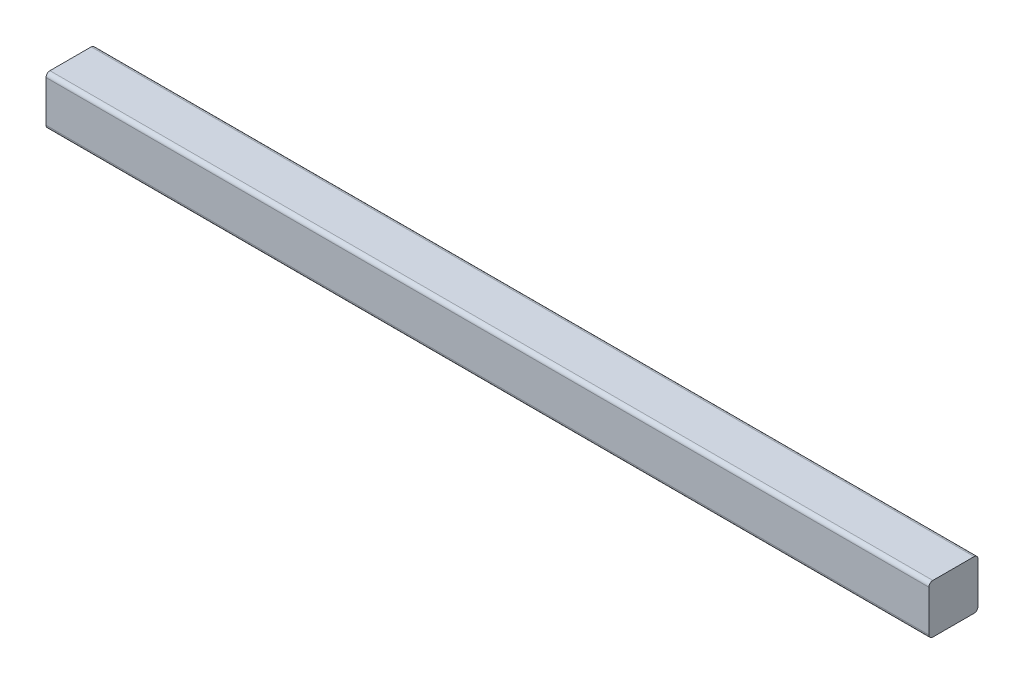
from build123d import *

# Parameters (mm, degrees)
SKETCH1_W           = 57.091934932
SKETCH1_H           = 3.175
BOSS_EXTRUDE1_DEPTH = 1.5875
FILLET1_R           = 0.254


with BuildPart() as part:
    # Sketch1 → Boss-Extrude1 (new, symmetric)
    with BuildSketch(Plane.XY):
        with Locations((16.893041934, 0)):
            Rectangle(SKETCH1_W, SKETCH1_H)
    extrude(amount=BOSS_EXTRUDE1_DEPTH, both=True)

    # Fillet1
    fillet1_edges = [part.edges().sort_by_distance(p)[0] for p in [
        (16.893041934, -1.5875, -1.5875),
        (16.893041934, -1.5875, 1.5875),
        (16.893041934, 1.5875, -1.5875),
        (16.893041934, 1.5875, 1.5875),
    ]]
    fillet(fillet1_edges, radius=FILLET1_R)


solid = part.part
